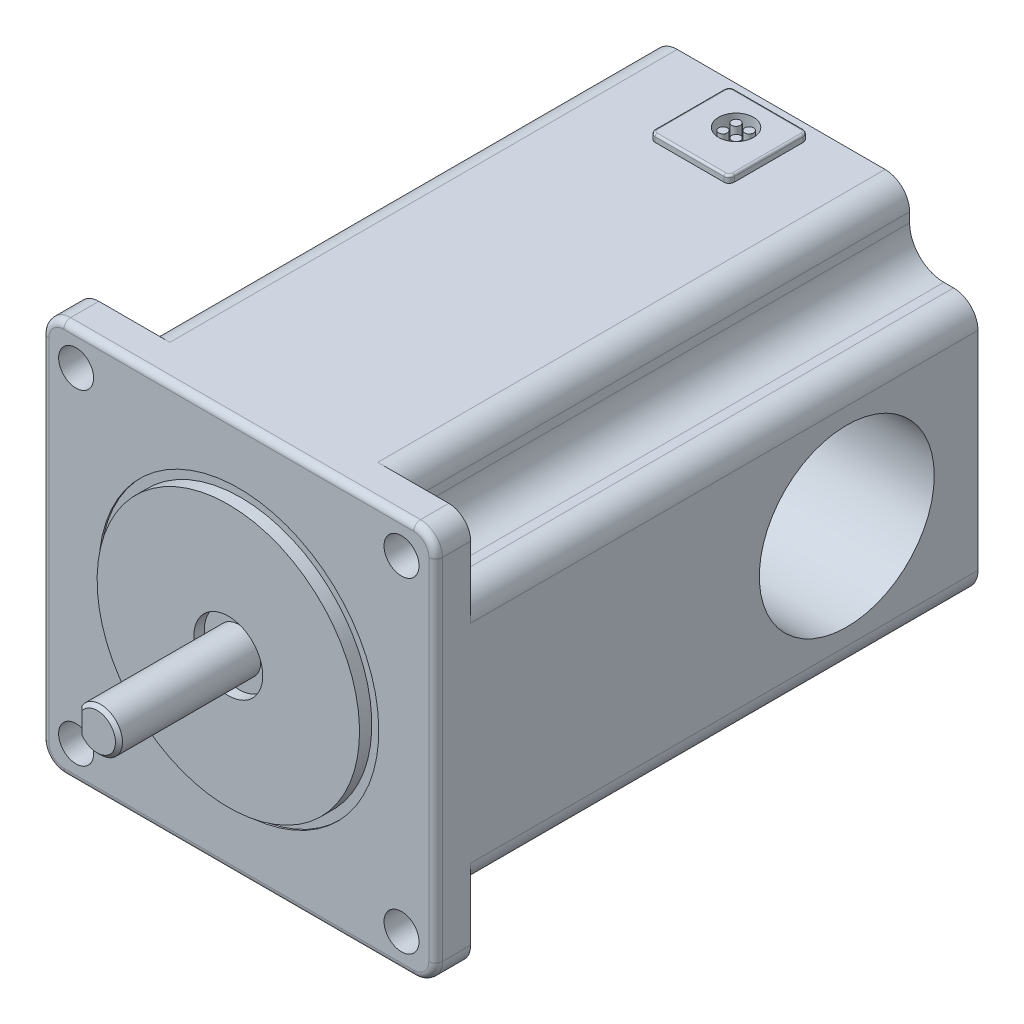
from build123d import *

# Parameters (mm, degrees)
BOSS_EXTRUDE1_DEPTH              = 5.08
FILLET1_R                        = 0.9906
BOSS_EXTRUDE2_DEPTH              = 73.66
SKETCH5_W                        = 1.524
SKETCH5_H                        = 19.05
SKETCH6_W                        = 0.254
SKETCH6_H                        = 1.27
SKETCH7_W                        = 99.314
SKETCH7_H                        = 3.175
CUT_EXTRUDE1_START               = -14.986
CUT_EXTRUDE1_DEPTH               = 14.986
CHAMFER1_SIZE                    = 0.508
SKETCH9_R                        = 2.54
CUT_EXTRUDE2_DEPTH               = 5.08
CUT_EXTRUDE3_DEPTH               = 1.2954
SKETCH11_R                       = 3.7465
SKETCH11_R_2                     = 2.54
BOSS_EXTRUDE3_DEPTH              = 1.2954
SKETCH12_W                       = 11.5062
SKETCH12_H                       = 11.5062
SKETCH12_R                       = 2.54
BOSS_EXTRUDE4_DEPTH              = 1.016
FILLET2_R                        = 0.762
FILLET3_R                        = 0.3048
SKETCH13_R                       = 0.635
BOSS_EXTRUDE5_DEPTH              = 1.9304
F_1_START                        = -4
F_1_1_DIAMETER_HOLE1_DEPTH       = 8
F_1_START_2                      = -28.575
F_1_1_DIAMETER_HOLE1_2_OUTLINE_R = 12.7
F_1_1_DIAMETER_HOLE1_2_DEPTH     = 57.15


with BuildPart() as part:
    # Sketch3 → Boss-Extrude1 (new body)
    with BuildSketch(Plane.XY):
        with BuildLine():
            Line((-28.575, -25.4), (-28.575, 25.4))
            ThreePointArc((-28.575, 25.4), (-27.64506403, 27.64506403), (-25.4, 28.575))
            Line((-25.4, 28.575), (25.4, 28.575))
            ThreePointArc((25.4, 28.575), (27.64506403, 27.64506403), (28.575, 25.4))
            Line((28.575, 25.4), (28.575, -25.4))
            ThreePointArc((28.575, -25.4), (27.64506403, -27.64506403), (25.4, -28.575))
            Line((25.4, -28.575), (-25.4, -28.575))
            ThreePointArc((-25.4, -28.575), (-27.64506403, -27.64506403), (-28.575, -25.4))
        make_face()
    extrude(amount=-BOSS_EXTRUDE1_DEPTH)

    # Fillet1
    fillet1_edges = [part.edges().sort_by_distance(p)[0] for p in [
        (-28.575, 0, 0),
        (-27.64506403, 27.64506403, 0),
        (0, 28.575, 0),
        (27.64506403, 27.64506403, 0),
        (28.575, 0, 0),
        (27.64506403, -27.64506403, 0),
        (0, -28.575, 0),
        (-27.64506403, -27.64506403, 0),
    ]]
    fillet(fillet1_edges, radius=FILLET1_R)

    # Sketch4 → Boss-Extrude2 (add)
    with BuildSketch(Plane.XY.offset(-5.08)):
        with BuildLine():
            Line((-25.019, 18.6436), (-23.622, 18.6436))
            ThreePointArc((-23.622, 18.6436), (-20.101739601, 20.101739601), (-18.6436, 23.622))
            Line((-18.6436, 23.622), (-18.6436, 25.019))
            ThreePointArc((-18.6436, 25.019), (-17.602071714, 27.533471714), (-15.0876, 28.575))
            Line((-15.0876, 28.575), (15.0876, 28.575))
            ThreePointArc((15.0876, 28.575), (17.602071714, 27.533471714), (18.6436, 25.019))
            Line((18.6436, 25.019), (18.6436, 23.622))
            ThreePointArc((18.6436, 23.622), (20.101739601, 20.101739601), (23.622, 18.6436))
            Line((23.622, 18.6436), (25.019, 18.6436))
            ThreePointArc((25.019, 18.6436), (27.533471714, 17.602071714), (28.575, 15.0876))
            Line((28.575, 15.0876), (28.575, -15.0876))
            ThreePointArc((28.575, -15.0876), (27.533471714, -17.602071714), (25.019, -18.6436))
            Line((25.019, -18.6436), (23.622, -18.6436))
            ThreePointArc((23.622, -18.6436), (20.101739601, -20.101739601), (18.6436, -23.622))
            Line((18.6436, -23.622), (18.6436, -25.019))
            ThreePointArc((18.6436, -25.019), (17.602071714, -27.533471714), (15.0876, -28.575))
            Line((15.0876, -28.575), (-15.0876, -28.575))
            ThreePointArc((-15.0876, -28.575), (-17.602071714, -27.533471714), (-18.6436, -25.019))
            Line((-18.6436, -25.019), (-18.6436, -23.622))
            ThreePointArc((-18.6436, -23.622), (-20.101739601, -20.101739601), (-23.622, -18.6436))
            Line((-23.622, -18.6436), (-25.019, -18.6436))
            ThreePointArc((-25.019, -18.6436), (-27.533471714, -17.602071714), (-28.575, -15.0876))
            Line((-28.575, -15.0876), (-28.575, 15.0876))
            ThreePointArc((-28.575, 15.0876), (-27.533471714, 17.602071714), (-25.019, 18.6436))
        make_face()
    extrude(amount=-BOSS_EXTRUDE2_DEPTH)

    # Sketch5 → Revolve1 (revolve)
    with BuildSketch(Plane(origin=(0, 0, 0), x_dir=(0, 0, -1), z_dir=(1, 0, 0))):
        with Locations((-0.762, 9.525)):
            Rectangle(SKETCH5_W, SKETCH5_H)
    revolve(axis=Axis((0, 0, 0), (0, 0, 1)))

    # Sketch6 → Cut-Revolve1 (revolve, cut)
    with BuildSketch(Plane(origin=(0, 0, 0), x_dir=(0, 0, -1), z_dir=(1, 0, 0)), mode=Mode.PRIVATE) as cut_revolve1_sk:
        Polygon((78.74, 0), (-1.524, 0), (-1.524, 4.99999), (0, 4.99999), (0, 3.175), (78.74, 3.175), align=None)
        with Locations((0.127, 19.685)):
            Rectangle(SKETCH6_W, SKETCH6_H)
    revolve(cut_revolve1_sk.sketch.rotate(Axis((0, 0, 20.574), (0, 0, -1)), 180), axis=Axis((0, 0, 20.574), (0, 0, -1)), mode=Mode.SUBTRACT)

    # Sketch9 → Cut-Extrude2 (cut)
    with BuildSketch(Plane.XY):
        with Locations((23.622, -23.622)):
            Circle(SKETCH9_R)
        with Locations((-23.622, -23.622)):
            Circle(SKETCH9_R)
        with Locations((-23.622, 23.622)):
            Circle(SKETCH9_R)
        with Locations((23.622, 23.622)):
            Circle(SKETCH9_R)
    extrude(amount=-CUT_EXTRUDE2_DEPTH, mode=Mode.SUBTRACT)

    # Sketch10 → Cut-Extrude3 (cut)
    with BuildSketch(Plane(origin=(0, 28.575, -0.751200197), x_dir=(1, 0, 0), z_dir=(0, 1, 0))):
        with BuildLine():
            Line((-3.8354, 71.440679803), (-3.8354, 66.487679803))
            Line((-3.8354, 66.487679803), (3.8354, 66.487679803))
            Line((3.8354, 66.487679803), (3.8354, 71.440679803))
            ThreePointArc((3.8354, 71.440679803), (0, 75.276079803), (-3.8354, 71.440679803))
        make_face()
    extrude(amount=-CUT_EXTRUDE3_DEPTH, mode=Mode.SUBTRACT)

    # Sketch11 → Boss-Extrude3 (add)
    with BuildSketch(Plane(origin=(0, 27.2796, 0), x_dir=(1, 0, 0), z_dir=(0, 1, 0))):
        with Locations(Location((0, 72.19188, 0), (0, 0, 270))):
            Circle(SKETCH11_R)
        with Locations(Location((0, 72.19188, 0), (0, 0, 270))):
            Circle(SKETCH11_R_2, mode=Mode.SUBTRACT)
    extrude(amount=BOSS_EXTRUDE3_DEPTH)

    # Sketch12 → Boss-Extrude4 (add)
    with BuildSketch(Plane(origin=(0, 28.575, 0), x_dir=(1, 0, 0), z_dir=(0, 1, 0))):
        with Locations((0, 71.18858)):
            Rectangle(SKETCH12_W, SKETCH12_H)
        with Locations(Location((0, 72.19188, 0), (0, 0, 270))):
            Circle(SKETCH12_R, mode=Mode.SUBTRACT)
    extrude(amount=BOSS_EXTRUDE4_DEPTH)

    # Fillet2
    fillet2_edges = [part.edges().sort_by_distance(p)[0] for p in [
        (5.7531, 29.083, -65.43548),
        (5.7531, 29.083, -76.94168),
        (-5.7531, 29.083, -76.94168),
        (-5.7531, 29.083, -65.43548),
    ]]
    fillet(fillet2_edges, radius=FILLET2_R)

    # Fillet3
    fillet3_edges = [part.edges().sort_by_distance(p)[0] for p in [
        (0, 29.591, -76.94168),
        (5.7531, 29.591, -71.18858),
        (-5.7531, 29.591, -71.18858),
        (0, 29.591, -65.43548),
        (-5.529915367, 29.591, -65.658664633),
        (5.529915367, 29.591, -65.658664633),
        (-5.529915367, 29.591, -76.718495367),
        (5.529915367, 29.591, -76.718495367),
    ]]
    fillet(fillet3_edges, radius=FILLET3_R)

    # Sketch13 → Boss-Extrude5 (add)
    with BuildSketch(Plane(origin=(0, 27.2796, 0), x_dir=(1, 0, 0), z_dir=(0, 1, 0))):
        with Locations(Location((-0.9525, 73.14438, 0), (0, 0, 270))):
            Circle(SKETCH13_R)
        with Locations(Location((0.9525, 73.14438, 0), (0, 0, 270))):
            Circle(SKETCH13_R)
        with Locations(Location((0.9525, 71.23938, 0), (0, 0, 270))):
            Circle(SKETCH13_R)
        with Locations(Location((-0.9525, 71.23938, 0), (0, 0, 270))):
            Circle(SKETCH13_R)
    extrude(amount=BOSS_EXTRUDE5_DEPTH)

    # 1 _1_ Diameter Hole1 2 outline → 1 _1_ Diameter Hole1 2 (cut)
    with BuildSketch(Plane.YZ.offset(F_1_START_2)):
        with Locations((0, -59.69)):
            Circle(F_1_1_DIAMETER_HOLE1_2_OUTLINE_R)
    extrude(amount=F_1_1_DIAMETER_HOLE1_2_DEPTH, mode=Mode.SUBTRACT)


with BuildPart() as body_2:
    # Sketch7 → Revolve2 (revolve)
    with BuildSketch(Plane(origin=(0, 0, 0), x_dir=(0, 0, -1), z_dir=(1, 0, 0)), mode=Mode.PRIVATE) as revolve2_sk:
        with Locations((29.083, 1.5875)):
            Rectangle(SKETCH7_W, SKETCH7_H)
    revolve(revolve2_sk.sketch.rotate(Axis((0, 0, 20.574), (0, 0, -1)), 180), axis=Axis((0, 0, 20.574), (0, 0, -1)))

    # Sketch8 → Cut-Extrude1 (cut)
    with BuildSketch(Plane.XY.offset(20.574).offset(CUT_EXTRUDE1_START)):
        with BuildLine():
            Line((-2.667, -1.722711816), (-2.667, 1.722711816))
            ThreePointArc((-2.667, 1.722711816), (-3.175, 0), (-2.667, -1.722711816))
        make_face()
    extrude(amount=CUT_EXTRUDE1_DEPTH, mode=Mode.SUBTRACT)

    # Chamfer1
    chamfer1_edges = [body_2.edges().sort_by_distance(p)[0] for p in [
        (-2.667, 0, 20.574),
        (0, 3.175, -78.74),
        (2.78838977, 1.51838977, 20.574),
    ]]
    chamfer(chamfer1_edges, length=CHAMFER1_SIZE - 0.0001)  # a hair under: the kernel refuses the full size

    # 1 (1) Diameter Hole1: read off the stored shape, not the designer's step
    # 1 (1) Diameter Hole1 outline → 1 (1) Diameter Hole1 (cut)
    with BuildSketch(Plane.YZ.offset(F_1_START)):
        with BuildLine():
            Line((5, -47.86463102), (3.175885622, -47.393506576))
            ThreePointArc((3.175885622, -47.393506576), (0.000456639, -46.990000008), (-3.175001353, -47.393278225))
            Line((-3.175001353, -47.393278225), (-5, -47.864491064))
            Line((-5, -47.864491064), (-5, -78.74))
            Line((-5, -78.74), (5, -78.74))
            Line((5, -78.74), (5, -47.86463102))
        make_face()
    extrude(amount=F_1_1_DIAMETER_HOLE1_DEPTH, mode=Mode.SUBTRACT)


solid = Compound([part.part, body_2.part])
